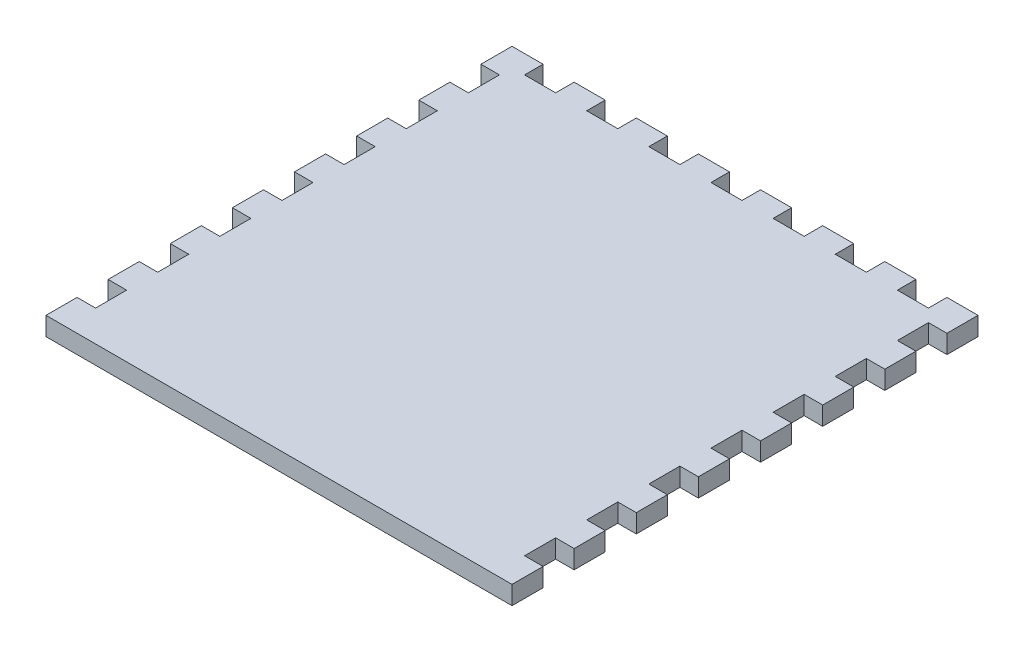
from build123d import *

# Parameters (mm, degrees)
SKETCH1_W                = 80
SKETCH1_H                = 80
BOSS_EXTRUDE1_DEPTH      = 3.175
CUT_EXTRUDE3_START       = -3.175
CUT_EXTRUDE3_OUTLINE_W   = 3.175
CUT_EXTRUDE3_OUTLINE_H   = 5.333333334
CUT_EXTRUDE3_OUTLINE_H_2 = 5.333333333
CUT_EXTRUDE3_OUTLINE_W_2 = 5.333333334
CUT_EXTRUDE3_OUTLINE_H_3 = 3.175
CUT_EXTRUDE3_OUTLINE_W_3 = 5.333333333
CUT_EXTRUDE3_DEPTH       = 3.175
SKETCH3_W                = 80
SKETCH3_H                = 5.333333333
BOSS_EXTRUDE2_DEPTH      = 3.175


# Read off the part's stored shape, not the designer's step: Cut-Extrude3
with BuildPart() as part:
    # Sketch1 → Boss-Extrude1 (new body)
    with BuildSketch(Plane(origin=(0, 0, 0), x_dir=(1, 0, 0), z_dir=(0, 1, 0))):
        Rectangle(SKETCH1_W, SKETCH1_H)
    extrude(amount=BOSS_EXTRUDE1_DEPTH)

    # Cut-Extrude3 outline → Cut-Extrude3 (cut)
    with BuildSketch(Plane(origin=(0, 3.175, 0), x_dir=(1, 0, 0), z_dir=(0, 1, 0)).offset(CUT_EXTRUDE3_START)):
        with Locations((-38.4125, 32)):
            Rectangle(CUT_EXTRUDE3_OUTLINE_W, CUT_EXTRUDE3_OUTLINE_H)
        with Locations((-38.4125, 21.333333334)):
            Rectangle(CUT_EXTRUDE3_OUTLINE_W, CUT_EXTRUDE3_OUTLINE_H_2)
        with Locations((-32, 38.4125)):
            Rectangle(CUT_EXTRUDE3_OUTLINE_W_2, CUT_EXTRUDE3_OUTLINE_H_3)
        with Locations((-38.4125, 10.666666666)):
            Rectangle(CUT_EXTRUDE3_OUTLINE_W, CUT_EXTRUDE3_OUTLINE_H_2)
        with Locations((-21.333333334, 38.4125)):
            Rectangle(CUT_EXTRUDE3_OUTLINE_W_3, CUT_EXTRUDE3_OUTLINE_H_3)
        with Locations((-38.4125, 0)):
            Rectangle(CUT_EXTRUDE3_OUTLINE_W, CUT_EXTRUDE3_OUTLINE_H)
        with Locations((-10.666666666, 38.4125)):
            Rectangle(CUT_EXTRUDE3_OUTLINE_W_3, CUT_EXTRUDE3_OUTLINE_H_3)
        with Locations((-38.4125, -10.666666666)):
            Rectangle(CUT_EXTRUDE3_OUTLINE_W, CUT_EXTRUDE3_OUTLINE_H_2)
        with Locations((0, 38.4125)):
            Rectangle(CUT_EXTRUDE3_OUTLINE_W_2, CUT_EXTRUDE3_OUTLINE_H_3)
        with Locations((-38.4125, -21.333333334)):
            Rectangle(CUT_EXTRUDE3_OUTLINE_W, CUT_EXTRUDE3_OUTLINE_H_2)
        with Locations((10.666666666, 38.4125)):
            Rectangle(CUT_EXTRUDE3_OUTLINE_W_3, CUT_EXTRUDE3_OUTLINE_H_3)
        with Locations((-38.4125, -32)):
            Rectangle(CUT_EXTRUDE3_OUTLINE_W, CUT_EXTRUDE3_OUTLINE_H)
        with Locations((21.333333334, 38.4125)):
            Rectangle(CUT_EXTRUDE3_OUTLINE_W_3, CUT_EXTRUDE3_OUTLINE_H_3)
        with Locations((32, 38.4125)):
            Rectangle(CUT_EXTRUDE3_OUTLINE_W_2, CUT_EXTRUDE3_OUTLINE_H_3)
        with Locations((-32, -38.4125)):
            Rectangle(CUT_EXTRUDE3_OUTLINE_W_2, CUT_EXTRUDE3_OUTLINE_H_3)
        with Locations((-21.333333334, -38.4125)):
            Rectangle(CUT_EXTRUDE3_OUTLINE_W_3, CUT_EXTRUDE3_OUTLINE_H_3)
        with Locations((38.4125, 32)):
            Rectangle(CUT_EXTRUDE3_OUTLINE_W, CUT_EXTRUDE3_OUTLINE_H)
        with Locations((-10.666666666, -38.4125)):
            Rectangle(CUT_EXTRUDE3_OUTLINE_W_3, CUT_EXTRUDE3_OUTLINE_H_3)
        with Locations((38.4125, 21.333333334)):
            Rectangle(CUT_EXTRUDE3_OUTLINE_W, CUT_EXTRUDE3_OUTLINE_H_2)
        with Locations((0, -38.4125)):
            Rectangle(CUT_EXTRUDE3_OUTLINE_W_2, CUT_EXTRUDE3_OUTLINE_H_3)
        with Locations((38.4125, 10.666666666)):
            Rectangle(CUT_EXTRUDE3_OUTLINE_W, CUT_EXTRUDE3_OUTLINE_H_2)
        with Locations((10.666666666, -38.4125)):
            Rectangle(CUT_EXTRUDE3_OUTLINE_W_3, CUT_EXTRUDE3_OUTLINE_H_3)
        with Locations((38.4125, 0)):
            Rectangle(CUT_EXTRUDE3_OUTLINE_W, CUT_EXTRUDE3_OUTLINE_H)
        with Locations((21.333333334, -38.4125)):
            Rectangle(CUT_EXTRUDE3_OUTLINE_W_3, CUT_EXTRUDE3_OUTLINE_H_3)
        with Locations((38.4125, -10.666666666)):
            Rectangle(CUT_EXTRUDE3_OUTLINE_W, CUT_EXTRUDE3_OUTLINE_H_2)
        with Locations((32, -38.4125)):
            Rectangle(CUT_EXTRUDE3_OUTLINE_W_2, CUT_EXTRUDE3_OUTLINE_H_3)
        with Locations((38.4125, -21.333333334)):
            Rectangle(CUT_EXTRUDE3_OUTLINE_W, CUT_EXTRUDE3_OUTLINE_H_2)
        with Locations((38.4125, -32)):
            Rectangle(CUT_EXTRUDE3_OUTLINE_W, CUT_EXTRUDE3_OUTLINE_H)
    extrude(amount=CUT_EXTRUDE3_DEPTH, mode=Mode.SUBTRACT)

    # Sketch3 → Boss-Extrude2 (add)
    with BuildSketch(Plane.XZ):
        with Locations((0, 37.333333334)):
            Rectangle(SKETCH3_W, SKETCH3_H)
    extrude(amount=-BOSS_EXTRUDE2_DEPTH)


solid = part.part
